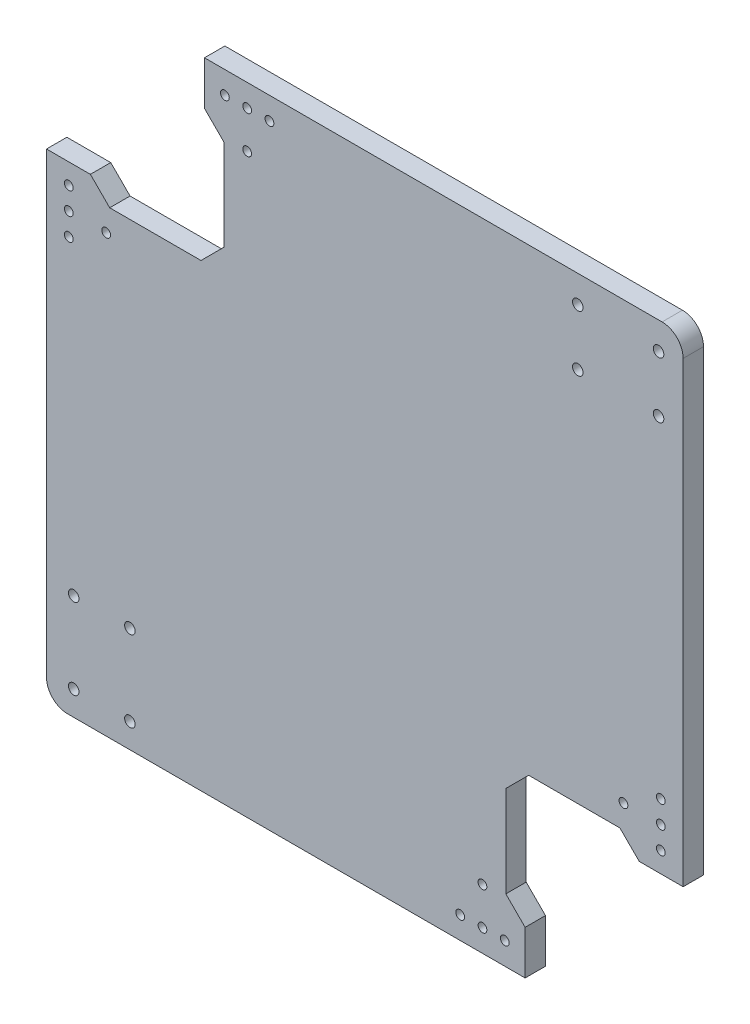
from build123d import *

# Parameters (mm, degrees)
BOSS_EXTRUDE1_DEPTH     = 11.6
CHAMFER1_SIZE           = 13
SKETCH2_W               = 25
SKETCH2_H               = 11.6
BOSS_EXTRUDE2_DEPTH     = 11
MIRROR2_COPY_1_SKETCH_W = 25
MIRROR2_COPY_1_SKETCH_H = 11.6
MIRROR2_COPY_1_DEPTH    = 11
CHAMFER2_SIZE           = 11
SKETCH3_R               = 2.5
CUT_EXTRUDE1_DEPTH      = 513.966745171
SKETCH4_R               = 3
CUT_EXTRUDE2_DEPTH      = 513.966745171
SKETCH5_R               = 2.5
CUT_EXTRUDE3_DEPTH      = 15
FILLET1_R               = 12


with BuildPart() as part:
    # Sketch1 → Boss-Extrude1 (new body)
    with BuildSketch(Plane.XY):
        Polygon((261.629509039, 0), (261.629509039, 101), (362.629509039, 101), (362.629509039, 362.629509039), (101, 362.629509039), (101, 261.629509039), (0, 261.629509039), (0, 0), align=None)
    extrude(amount=BOSS_EXTRUDE1_DEPTH)

    # Chamfer1
    chamfer1_edges = [part.edges().sort_by_distance(p)[0] for p in [
        (101, 261.629509039, 5.8),
        (261.629509039, 101, 5.8),
    ]]
    chamfer(chamfer1_edges, length=CHAMFER1_SIZE)

    # Sketch2 → Boss-Extrude2 (add)
    with BuildSketch(Plane.XZ.offset(-101)):
        with Locations((350.129509039, 5.8)):
            Rectangle(SKETCH2_W, SKETCH2_H)
    boss_extrude2 = extrude(amount=BOSS_EXTRUDE2_DEPTH)

    # Mirror1: Boss-Extrude2 across plane
    add(boss_extrude2.mirror(Plane(origin=(181.31475452, 181.31475452, 0), x_dir=(0, 0, 1), z_dir=(-0.7071067811865472, -0.7071067811865479, -3.1401849173675514e-15))))

    # Mirror2: Boss-Extrude2 across plane
    add(boss_extrude2.mirror(Plane(origin=(0, 0, 0), x_dir=(0, 0, 1), z_dir=(0.7071067811865475, -0.7071067811865477, 0))))

    # Mirror2 copy 1 sketch → Mirror2 copy 1 (add)
    with BuildSketch(Plane(origin=(362.629509039, 261.629509039, 0), x_dir=(-1, 0, 0), z_dir=(0, 1, 0))):
        with Locations((350.129509039, 5.8)):
            Rectangle(MIRROR2_COPY_1_SKETCH_W, MIRROR2_COPY_1_SKETCH_H)
    extrude(amount=MIRROR2_COPY_1_DEPTH)

    # Chamfer2
    chamfer2_edges = [part.edges().sort_by_distance(p)[0] for p in [
        (101, 337.629509039, 5.8),
        (25, 261.629509039, 5.8),
        (261.629509039, 25, 5.8),
        (337.629509039, 101, 5.8),
    ]]
    chamfer(chamfer2_edges, length=CHAMFER2_SIZE - 0.0001)  # a hair under: the kernel refuses the full size

    # Sketch3 → Cut-Extrude1 (cut, through all)
    with BuildSketch(Plane.XY.offset(11.6)):
        with Locations((261.029509039, 12.7)):
            Circle(SKETCH3_R)
        with Locations((248.329509039, 12.7)):
            Circle(SKETCH3_R)
        with Locations((235.629509039, 12.7)):
            Circle(SKETCH3_R)
        with Locations((349.929509039, 101.6)):
            Circle(SKETCH3_R)
        with Locations((349.929509039, 114.3)):
            Circle(SKETCH3_R)
        with Locations((349.929509039, 127)):
            Circle(SKETCH3_R)
        with Locations((127, 349.929509039)):
            Circle(SKETCH3_R)
        with Locations((114.3, 349.929509039)):
            Circle(SKETCH3_R)
        with Locations((101.6, 349.929509039)):
            Circle(SKETCH3_R)
        with Locations((12.7, 261.029509039)):
            Circle(SKETCH3_R)
        with Locations((12.7, 235.629509039)):
            Circle(SKETCH3_R)
        with Locations((12.7, 248.329509039)):
            Circle(SKETCH3_R)
    extrude(amount=-CUT_EXTRUDE1_DEPTH, mode=Mode.SUBTRACT)

    # Sketch4 → Cut-Extrude2 (cut, through all)
    with BuildSketch(Plane.XY.offset(11.6)):
        with Locations((15.5, 14)):
            Circle(SKETCH4_R)
        with Locations((47.5, 14)):
            Circle(SKETCH4_R)
        with Locations((47.5, 60)):
            Circle(SKETCH4_R)
        with Locations((15.5, 60)):
            Circle(SKETCH4_R)
    cut_extrude2 = extrude(amount=-CUT_EXTRUDE2_DEPTH, mode=Mode.SUBTRACT)

    # Mirror3: Cut-Extrude2 across plane
    add(cut_extrude2.mirror(Plane(origin=(181.31475452, 181.31475452, 0), x_dir=(0, 0, 1), z_dir=(-0.7071067811865472, -0.7071067811865479, -3.1401849173675514e-15))), mode=Mode.SUBTRACT)

    # Sketch5 → Cut-Extrude3 (cut)
    with BuildSketch(Plane.XY.offset(11.6)):
        with Locations((248.329509039, 34)):
            Circle(SKETCH5_R)
        with Locations((328.629509039, 114.3)):
            Circle(SKETCH5_R)
        with Locations((114.3, 328.629509039)):
            Circle(SKETCH5_R)
        with Locations((34, 248.329509039)):
            Circle(SKETCH5_R)
    extrude(amount=-CUT_EXTRUDE3_DEPTH, mode=Mode.SUBTRACT)

    # Fillet1
    fillet1_edges = [part.edges().sort_by_distance(p)[0] for p in [
        (0, 0, 5.8),
        (362.629509039, 362.629509039, 5.8),
    ]]
    fillet(fillet1_edges, radius=FILLET1_R)


solid = part.part
